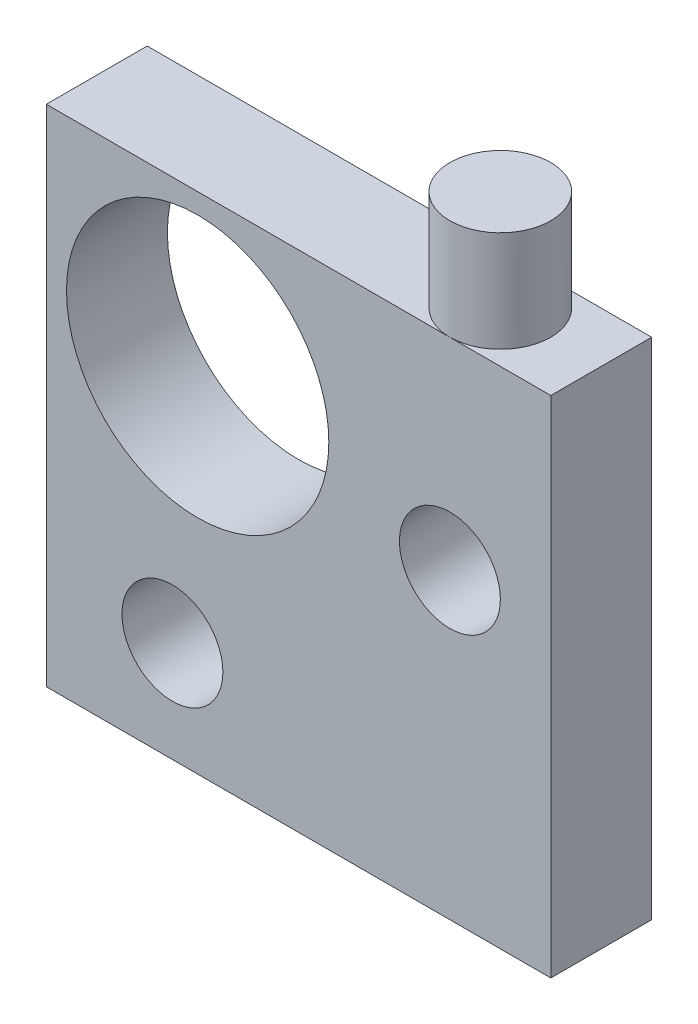
from build123d import *

# Parameters (mm, degrees)
SKETCH_1_W          = 80
SKETCH_1_H          = 60
EXTRUDE_1_DEPTH     = 10
CUT_EXTRUDE_1_DEPTH = 10
SKETCH_3_R          = 5
SKETCH_3_R_2        = 13
CUT_EXTRUDE_2_DEPTH = 51.990195136
SKETCH_4_W          = 30
SKETCH_4_H          = 50
CUT_EXTRUDE_3_DEPTH = 51.990195136


with BuildPart() as part:
    # 草图1 → 凸台-拉伸1 (new body)
    with BuildSketch(Plane.XY):
        Rectangle(SKETCH_1_W, SKETCH_1_H)
    extrude(amount=EXTRUDE_1_DEPTH)

    # 草图2 → 切除-拉伸1 (cut)
    with BuildSketch(Plane(origin=(0, 30, 0), x_dir=(1, 0, 0), z_dir=(0, 1, 0))):
        with BuildLine():
            ThreePointArc((4.7e-08, 0), (5, -5.000000004), (3.8e-08, -10))
            Line((3.8e-08, -10), (40, -10))
            Line((40, -10), (40, 0))
            Line((40, 0), (4.7e-08, 0))
        make_face()
        with BuildLine():
            ThreePointArc((3.8e-08, -10), (-5, -4.999999996), (4.7e-08, 0))
            Line((4.7e-08, 0), (-40, 0))
            Line((-40, 0), (-40, -10))
            Line((-40, -10), (3.8e-08, -10))
        make_face()
    extrude(amount=-CUT_EXTRUDE_1_DEPTH, mode=Mode.SUBTRACT)

    # 草图3 → 切除-拉伸2 (cut, through all)
    with BuildSketch(Plane.XY.offset(10)):
        with Locations((-27.5, -20)):
            Circle(SKETCH_3_R)
        Circle(SKETCH_3_R)
        with Locations((-25, 5)):
            Circle(SKETCH_3_R_2)
    extrude(amount=-CUT_EXTRUDE_2_DEPTH, mode=Mode.SUBTRACT)

    # 草图4 → 切除-拉伸3 (cut, through all)
    with BuildSketch(Plane.XY.offset(10)):
        with Locations((25, -5)):
            Rectangle(SKETCH_4_W, SKETCH_4_H)
    extrude(amount=-CUT_EXTRUDE_3_DEPTH, mode=Mode.SUBTRACT)


solid = part.part
